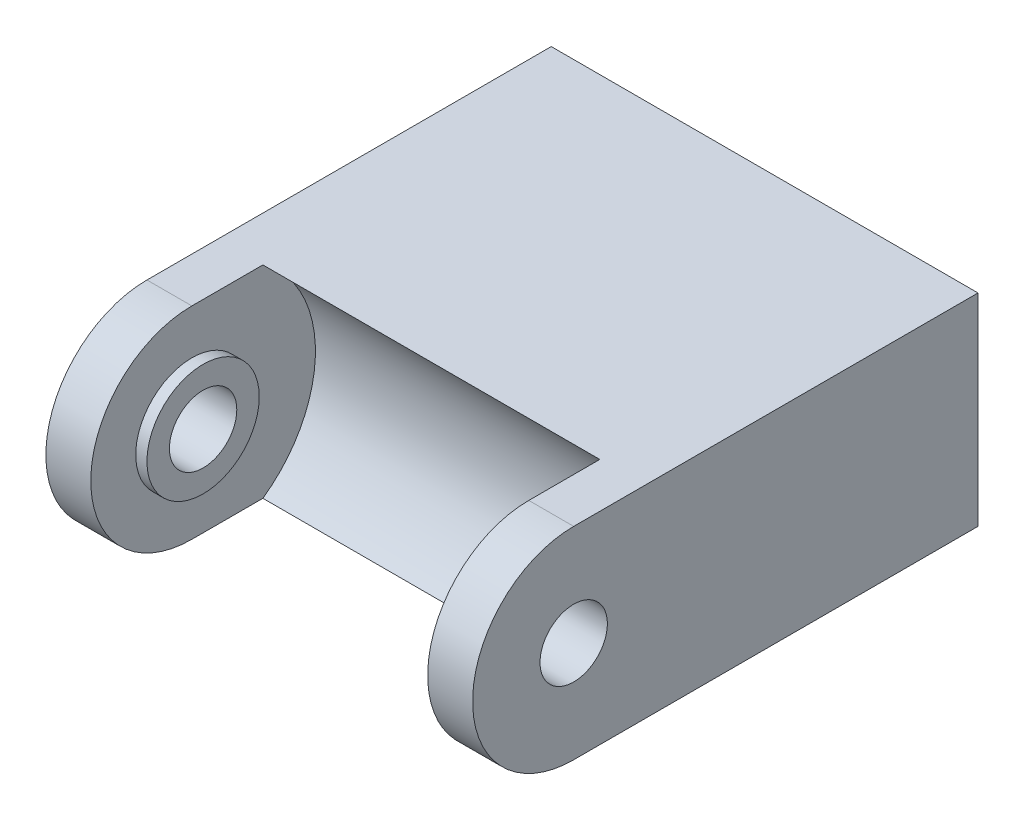
from build123d import *
from build123d.topology import SkipClean

# Parameters (mm, degrees)
EXTRUDE_1_DEPTH          = 9.5
EXTRUDE_1_DEPTH_BACK     = 9.5
CUT_EXTRUDE_1_DEPTH      = 7
CUT_EXTRUDE_1_DEPTH_BACK = 7
SKETCH_2_R               = 5.5
CUT_EXTRUDE_2_DEPTH      = 21.844663586
CUT_EXTRUDE_2_DEPTH_BACK = 21.844663586
SKETCH_3_R               = 1.5
CUT_EXTRUDE_3_DEPTH      = 7.5
CUT_EXTRUDE_3_DEPTH_BACK = 7.5
SKETCH_4_R               = 5.5
SKETCH_4_R_2             = 2.5
SKETCH_5_R               = 1.75
CUT_EXTRUDE_4_DEPTH      = 2


with BuildPart() as part:
    # Эскиз1 → Бобышка-Вытянуть1 (new, two sides: drawn at the far end of the back side and taken through both)
    with BuildSketch(Plane(origin=(0, 0, 0), x_dir=(0, 0, -1), z_dir=(1, 0, 0)).offset(-EXTRUDE_1_DEPTH_BACK)):
        with BuildLine():
            Line((18, 4.5), (0, 4.5))
            ThreePointArc((0, 4.5), (-4.5, 0), (0, -4.5))
            Line((0, -4.5), (18, -4.5))
            Line((18, -4.5), (18, 4.5))
        make_face()
    extrude(amount=EXTRUDE_1_DEPTH + EXTRUDE_1_DEPTH_BACK)

    # Эскиз2 → Вырез-Вытянуть1 (cut, two sides: drawn at the far end of the back side and taken through both)
    with BuildSketch(Plane(origin=(0, 0, 0), x_dir=(0, 0, -1), z_dir=(1, 0, 0)).offset(-CUT_EXTRUDE_1_DEPTH_BACK)):
        Circle(SKETCH_2_R)
    extrude(amount=CUT_EXTRUDE_1_DEPTH + CUT_EXTRUDE_1_DEPTH_BACK, mode=Mode.SUBTRACT)

    # Эскиз3 → Вырез-Вытянуть2 (cut, two sides: drawn at the far end of the back side and taken through both)
    with BuildSketch(Plane(origin=(0, 0, 0), x_dir=(0, 0, -1), z_dir=(1, 0, 0)).offset(-CUT_EXTRUDE_2_DEPTH_BACK)):
        Circle(SKETCH_3_R)
    extrude(amount=CUT_EXTRUDE_2_DEPTH + CUT_EXTRUDE_2_DEPTH_BACK, mode=Mode.SUBTRACT)

    # Эскиз4 → Вырез-Вытянуть3 (cut, two sides: drawn at the far end of the back side and taken through both)
    with SkipClean():  # the faces are left unmerged after this step: merging them gives an invalid solid
        with BuildSketch(Plane(origin=(0, 0, 0), x_dir=(0, 0, -1), z_dir=(1, 0, 0)).offset(-CUT_EXTRUDE_3_DEPTH_BACK)):
            Circle(SKETCH_4_R)
            Circle(SKETCH_4_R_2, mode=Mode.SUBTRACT)
        extrude(amount=CUT_EXTRUDE_3_DEPTH + CUT_EXTRUDE_3_DEPTH_BACK, mode=Mode.SUBTRACT)
    add(part.part.scale(1), mode=Mode.REPLACE)  # the faces are merged on a copy

    # Эскиз5 → Вырез-Вытянуть4 (cut)
    with BuildSketch(Plane(origin=(0, 0, -18), x_dir=(-1, 0, 0), z_dir=(0, 0, -1))):
        Circle(SKETCH_5_R)
    extrude(amount=-CUT_EXTRUDE_4_DEPTH, mode=Mode.SUBTRACT)


solid = part.part
